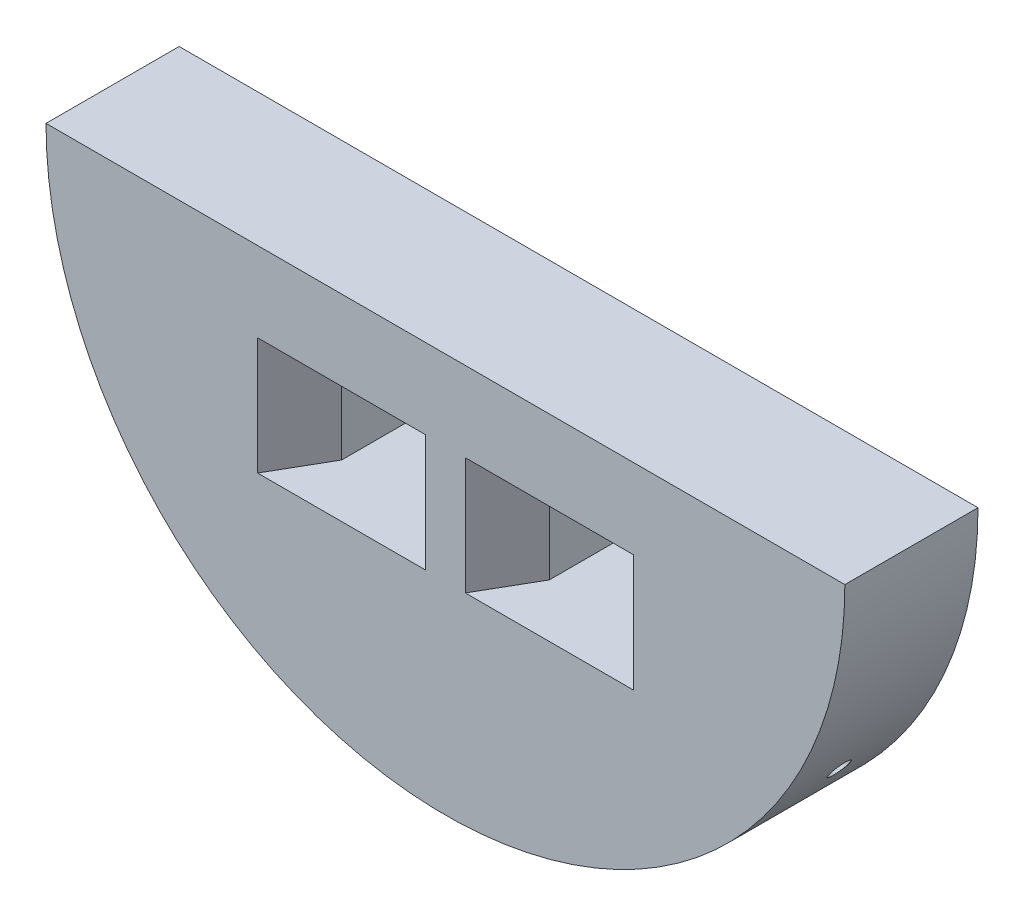
from build123d import *
from OCP.BRepFilletAPI import BRepFilletAPI_MakeChamfer

# Parameters (mm, degrees)
SKETCH1_W           = 20
SKETCH1_H           = 22
BOSS_EXTRUDE1_DEPTH = 25
CIRPATTERN1_COUNT   = 5
CIRPATTERN1_ANGLE   = 110
CHAMFER1_SIZE       = 15
CHAMFER1_SIZE2      = 8.660254038
CHAMFER3_SIZE       = 10
CHAMFER3_SIZE2      = 5.773502692


with BuildPart() as part:
    # Sketch1 → Boss-Extrude1 (new body)
    with BuildSketch(Plane.XY):
        with BuildLine():
            Line((-150, 0), (0, 0))
            ThreePointArc((0, 0), (-75, -75), (-150, 0))
        make_face()
        with Locations((-55.5, -26)):
            Rectangle(SKETCH1_W, SKETCH1_H, mode=Mode.SUBTRACT)
        with Locations((-94.5, -26)):
            Rectangle(SKETCH1_W, SKETCH1_H, mode=Mode.SUBTRACT)
    extrude(amount=BOSS_EXTRUDE1_DEPTH)

    # Sketch4 → Ø4.0mm Dowel Hole2 (revolve, cut)
    with BuildSketch(Plane(origin=(-13.563596678, -43.018232726, 12.5), x_dir=(0.5735764363510469, 0.8191520442889914, 0), z_dir=(0, 0, 1))):
        Polygon((0, 0), (0, 17.201721238), (2, 16), (2, 0.025), (2.025, 0), align=None)
    f_4_0mm_dowel_hole2 = revolve(axis=Axis((-8.361981197, -46.660443097, 12.5), (-0.8191520442889912, 0.5735764363510467, 0)), mode=Mode.SUBTRACT)

    # CirPattern1: Ø4.0mm Dowel Hole2 ×5 about axis
    cirpattern1_axis = Axis((-75, 0, 0), (0, 0, -1))
    for i in range(1, CIRPATTERN1_COUNT):
        add(f_4_0mm_dowel_hole2.rotate(cirpattern1_axis, i * CIRPATTERN1_ANGLE / (CIRPATTERN1_COUNT - 1)), mode=Mode.SUBTRACT)

    # Chamfer1: one chamfer whose edges measure the first distance from different faces: ONE call of the kernel's chamfer builder (chamfer() names one face for all edges)
    chamfer1_edges_1 = [part.edges().sort_by_distance(p)[0] for p in [
        (-94.5, -15, 0),
    ]]
    chamfer1_side_1 = [part.faces().sort_by_distance(p)[0] for p in [
        (-94.5, -15, 12.5),
    ]]
    chamfer1_edges_2 = [part.edges().sort_by_distance(p)[0] for p in [
        (-55.5, -15, 0),
    ]]
    chamfer1_side_2 = [part.faces().sort_by_distance(p)[0] for p in [
        (-55.5, -15, 12.5),
    ]]
    chamfer1 = BRepFilletAPI_MakeChamfer(part.part.solid().wrapped)
    for e in chamfer1_edges_1:
        chamfer1.Add(CHAMFER1_SIZE, CHAMFER1_SIZE2, e.wrapped, chamfer1_side_1[0].wrapped)  # the first distance lies on this face
    for e in chamfer1_edges_2:
        chamfer1.Add(CHAMFER1_SIZE, CHAMFER1_SIZE2, e.wrapped, chamfer1_side_2[0].wrapped)  # the first distance lies on this face
    add(Compound.cast(chamfer1.Shape()), mode=Mode.REPLACE)

    # Chamfer3: one chamfer whose edges measure the first distance from different faces: ONE call of the kernel's chamfer builder (chamfer() names one face for all edges)
    chamfer3_edges_1 = [part.edges().sort_by_distance(p)[0] for p in [
        (-104.5, -26, 25),
    ]]
    chamfer3_side_1 = [part.faces().sort_by_distance(p)[0] for p in [
        (-104.5, -24.533265853, 11.707841645),
    ]]
    chamfer3_edges_2 = [part.edges().sort_by_distance(p)[0] for p in [
        (-84.5, -26, 25),
    ]]
    chamfer3_side_2 = [part.faces().sort_by_distance(p)[0] for p in [
        (-84.5, -24.533265853, 11.707841645),
    ]]
    chamfer3_edges_3 = [part.edges().sort_by_distance(p)[0] for p in [
        (-45.5, -26, 25),
    ]]
    chamfer3_side_3 = [part.faces().sort_by_distance(p)[0] for p in [
        (-45.5, -24.533265853, 11.707841645),
    ]]
    chamfer3_edges_4 = [part.edges().sort_by_distance(p)[0] for p in [
        (-65.5, -26, 25),
    ]]
    chamfer3_side_4 = [part.faces().sort_by_distance(p)[0] for p in [
        (-65.5, -24.533265853, 11.707841645),
    ]]
    chamfer3 = BRepFilletAPI_MakeChamfer(part.part.solid().wrapped)
    for e in chamfer3_edges_1:
        chamfer3.Add(CHAMFER3_SIZE, CHAMFER3_SIZE2, e.wrapped, chamfer3_side_1[0].wrapped)  # the first distance lies on this face
    for e in chamfer3_edges_2:
        chamfer3.Add(CHAMFER3_SIZE, CHAMFER3_SIZE2, e.wrapped, chamfer3_side_2[0].wrapped)  # the first distance lies on this face
    for e in chamfer3_edges_3:
        chamfer3.Add(CHAMFER3_SIZE, CHAMFER3_SIZE2, e.wrapped, chamfer3_side_3[0].wrapped)  # the first distance lies on this face
    for e in chamfer3_edges_4:
        chamfer3.Add(CHAMFER3_SIZE, CHAMFER3_SIZE2, e.wrapped, chamfer3_side_4[0].wrapped)  # the first distance lies on this face
    add(Compound.cast(chamfer3.Shape()), mode=Mode.REPLACE)


solid = part.part
